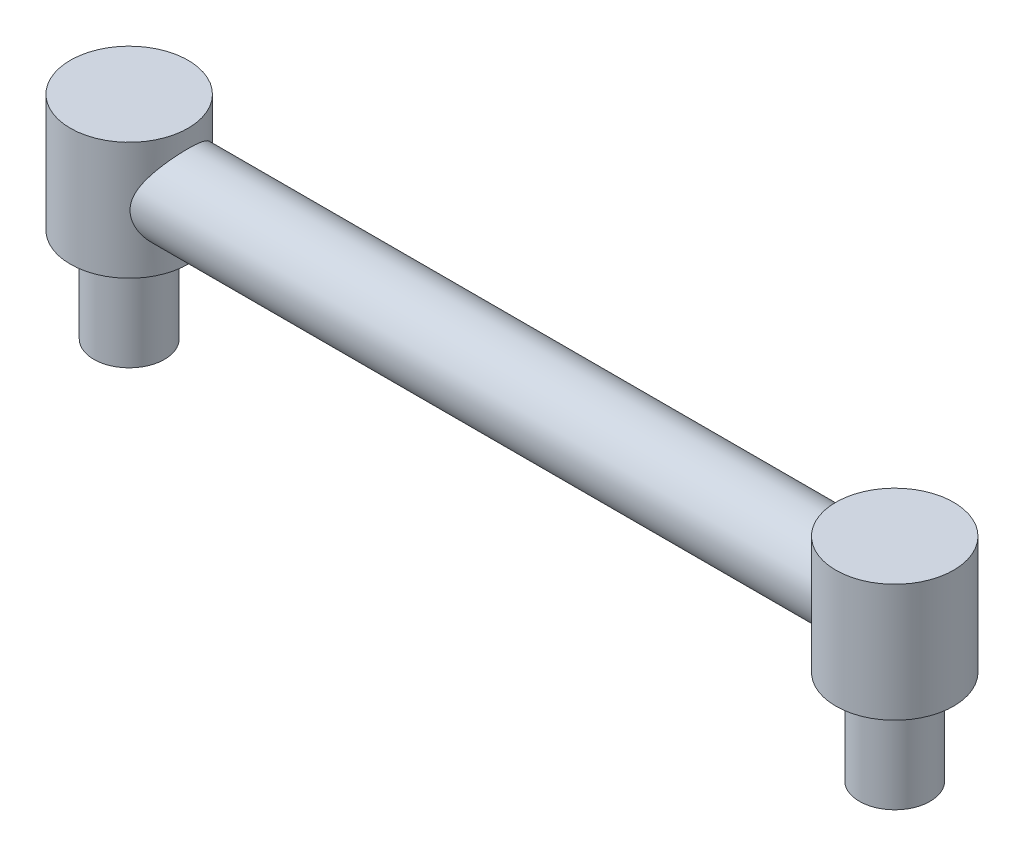
from build123d import *

# Parameters (mm, degrees)
CROQUIS3_R              = 3.5
SALIENTE_EXTRUIR1_DEPTH = 65
CROQUIS4_R              = 5
SALIENTE_EXTRUIR2_DEPTH = 5
CROQUIS5_R              = 3
SALIENTE_EXTRUIR3_DEPTH = 8


with BuildPart() as part:
    # Croquis3 → Saliente-Extruir1 (new body)
    with BuildSketch(Plane(origin=(0, 0, 0), x_dir=(0, 0, -1), z_dir=(1, 0, 0))):
        Circle(CROQUIS3_R)
    extrude(amount=SALIENTE_EXTRUIR1_DEPTH)

    # Croquis4 → Saliente-Extruir2 (add, symmetric)
    with BuildSketch(Plane(origin=(0, 0, 0), x_dir=(1, 0, 0), z_dir=(0, 1, 0))):
        with Locations((65, 0)):
            Circle(CROQUIS4_R)
        Circle(CROQUIS4_R)
    extrude(amount=SALIENTE_EXTRUIR2_DEPTH, both=True)

    # Croquis5 → Saliente-Extruir3 (add)
    with BuildSketch(Plane.XZ.offset(5)):
        with Locations((65, 0)):
            Circle(CROQUIS5_R)
        Circle(CROQUIS5_R)
    extrude(amount=SALIENTE_EXTRUIR3_DEPTH)


solid = part.part
